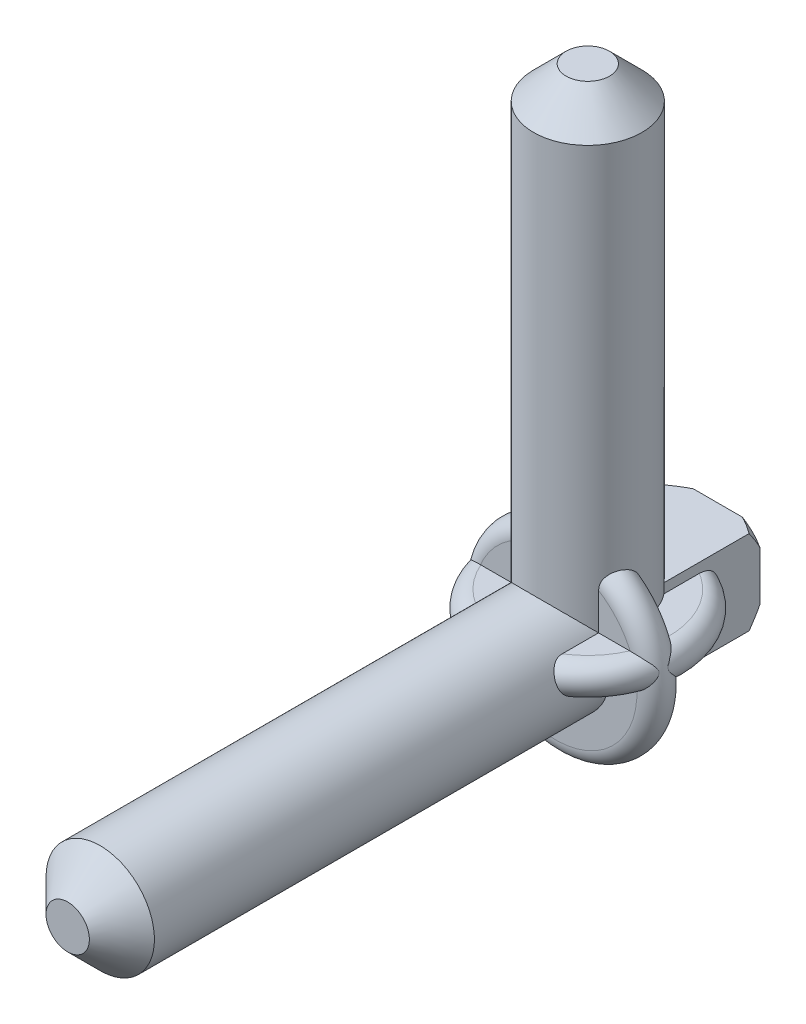
from build123d import *

# Parameters (mm, degrees)
SKETCH4_R           = 5.5
BOSS_EXTRUDE3_DEPTH = 12
CHAMFER2_SIZE       = 1
SKETCH5_OUTSIDE_W   = 33.118
SKETCH5_OUTSIDE_H   = 33.118
SKETCH5_OUTSIDE_W_2 = 7.778174594
SKETCH5_OUTSIDE_H_2 = 7.778174594
CUT_EXTRUDE1_DEPTH  = 12
SKETCH1_R           = 5
BOSS_EXTRUDE1_DEPTH = 45
CHAMFER1_SIZE       = 3
SKETCH2_R           = 9
BOSS_EXTRUDE2_DEPTH = 3
FILLET1_R           = 1.5


with BuildPart() as part:
    # Sketch3 → Revolve1 (revolve)
    with BuildSketch(Plane(origin=(0, 0, 0), x_dir=(1, 0, 0), z_dir=(0, 1, 0))):
        with BuildLine():
            Line((0, 0), (0, -48))
            Line((0, -48), (-2, -48))
            Line((-2, -48), (-5, -45))
            Line((-5, -45), (-5, -2.999542577))
            Line((-5, -2.999542577), (-7.537041341, -2.999542577))
            ThreePointArc((-7.537041341, -2.999542577), (-9.036926981, -1.481020494), (-7.5, 0))
            Line((-7.5, 0), (0, 0))
        make_face()
    revolve(axis=Axis((0, 0, 0), (0, 0, 1)))

    # Sketch4 → Boss-Extrude3 (add)
    with BuildSketch(Plane(origin=(0, 0, 0), x_dir=(-1, 0, 0), z_dir=(0, 0, -1))):
        with Locations(Location((0, 0, 0), (0, 0, 180))):
            Circle(SKETCH4_R)
    extrude(amount=BOSS_EXTRUDE3_DEPTH)

    # Chamfer2
    chamfer2_edges = [part.edges().sort_by_distance(p)[0] for p in [
        (-5.5, 0, -12),
    ]]
    chamfer(chamfer2_edges, length=CHAMFER2_SIZE)

    # Sketch5 outside → Cut-Extrude1 (cut)
    with BuildSketch(Plane(origin=(0, 0, -12), x_dir=(-1, 0, 0), z_dir=(0, 0, -1))):
        Rectangle(SKETCH5_OUTSIDE_W, SKETCH5_OUTSIDE_H)
        Rectangle(SKETCH5_OUTSIDE_W_2, SKETCH5_OUTSIDE_H_2, mode=Mode.SUBTRACT)
    extrude(amount=-CUT_EXTRUDE1_DEPTH, mode=Mode.SUBTRACT)


with BuildPart() as body_2:
    # Sketch1 → Boss-Extrude1 (new body)
    with BuildSketch(Plane(origin=(0, 0, 0), x_dir=(1, 0, 0), z_dir=(0, 1, 0))):
        with Locations(Location((0, 0, 0), (0, 0, 90))):
            Circle(SKETCH1_R)
    extrude(amount=BOSS_EXTRUDE1_DEPTH)

    # Chamfer1
    chamfer1_edges = [body_2.edges().sort_by_distance(p)[0] for p in [
        (0, 45, 5),
    ]]
    chamfer(chamfer1_edges, length=CHAMFER1_SIZE)

    # Sketch2 → Boss-Extrude2 (add)
    with BuildSketch(Plane.XZ):
        with Locations(Location((0, 0, 0), (0, 0, 270))):
            Circle(SKETCH2_R)
    extrude(amount=-BOSS_EXTRUDE2_DEPTH)

    # Fillet1
    fillet1_edges = [body_2.edges().sort_by_distance(p)[0] for p in [
        (0, 3, 9),
        (0, 0, 9),
    ]]
    fillet(fillet1_edges, radius=FILLET1_R - 0.0001)  # a hair under: the kernel refuses the full size


solid = Compound([part.part, body_2.part])
